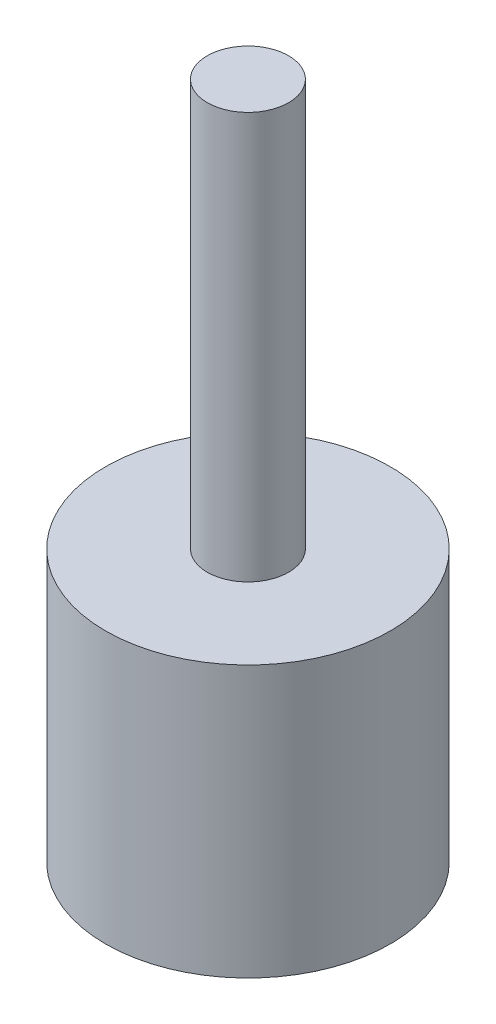
from build123d import *

# Parameters (mm, degrees)
SKETCH1_R           = 5.25
BOSS_EXTRUDE1_DEPTH = 10
SKETCH2_R           = 1.5
BOSS_EXTRUDE2_DEPTH = 15
CUT_EXTRUDE1_DEPTH  = 8


with BuildPart() as part:
    # Sketch1 → Boss-Extrude1 (new body)
    with BuildSketch(Plane(origin=(0, 0, 0), x_dir=(1, 0, 0), z_dir=(0, 1, 0))):
        Circle(SKETCH1_R)
    extrude(amount=BOSS_EXTRUDE1_DEPTH)

    # Sketch2 → Boss-Extrude2 (add)
    with BuildSketch(Plane(origin=(0, 10, 0), x_dir=(1, 0, 0), z_dir=(0, 1, 0))):
        Circle(SKETCH2_R)
    extrude(amount=BOSS_EXTRUDE2_DEPTH)

    # Sketch3 → Cut-Extrude1 (cut)
    with BuildSketch(Plane.XZ):
        Polygon((4, 0), (2, 3.464101615), (-2, 3.464101615), (-4, 0), (-2, -3.464101615), (2, -3.464101615), align=None)
    extrude(amount=-CUT_EXTRUDE1_DEPTH, mode=Mode.SUBTRACT)


solid = part.part
